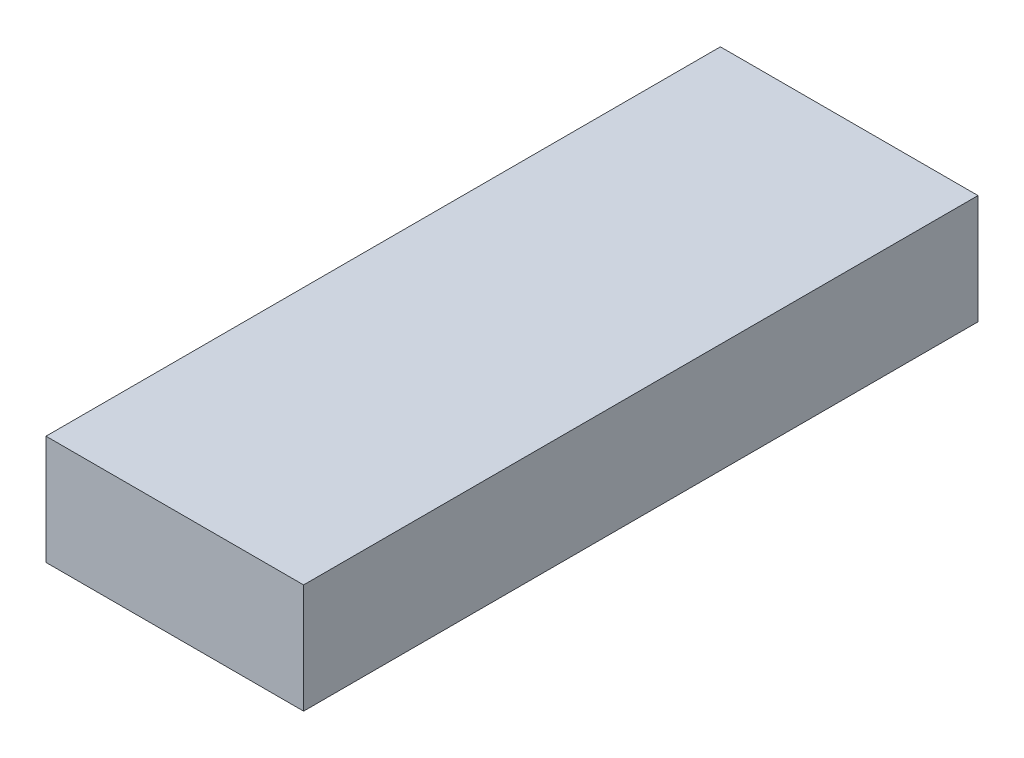
from build123d import *

# Parameters (mm, degrees)
SKETCH1_W           = 26.924
SKETCH1_H           = 70.485
BOSS_EXTRUDE1_DEPTH = 5.715


with BuildPart() as part:
    # Sketch1 → Boss-Extrude1 (new, symmetric)
    with BuildSketch(Plane(origin=(0, 0, 0), x_dir=(1, 0, 0), z_dir=(0, 1, 0))):
        Rectangle(SKETCH1_W, SKETCH1_H)
    extrude(amount=BOSS_EXTRUDE1_DEPTH, both=True)


solid = part.part
